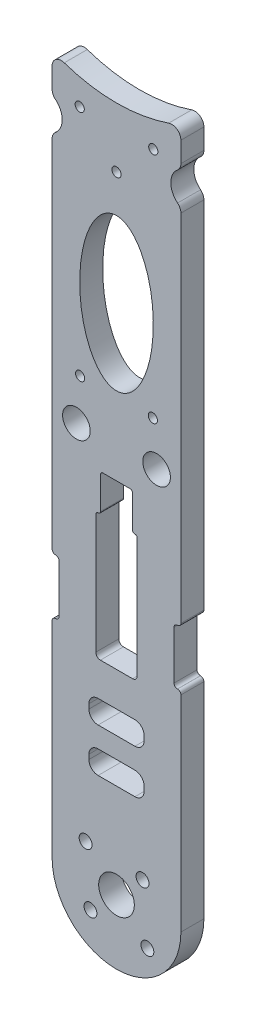
from build123d import *

# Parameters (mm, degrees)
SKETCH1_R           = 1
SKETCH1_R_2         = 1.4
SKETCH1_R_3         = 3
SKETCH1_RX          = 16.5
SKETCH1_RY          = 8
BOSS_EXTRUDE1_DEPTH = 5
CUT_EXTRUDE1_REACH  = 153.803
SKETCH2_R           = 3.875


with BuildPart() as part:
    # Sketch1 → Boss-Extrude1 (new body)
    with BuildSketch(Plane.XY):
        with BuildLine():
            Line((-14, 0), (-14, 44.641437436))
            ThreePointArc((-14, 44.641437436), (-13.783259018, 45.164696454), (-13.26, 45.381437436))
            Line((-13.26, 45.381437436), (-13.24, 45.381437436))
            ThreePointArc((-13.24, 45.381437436), (-12.716740982, 45.598178417), (-12.5, 46.121437436))
            Line((-12.5, 46.121437436), (-12.5, 56.641437436))
            ThreePointArc((-12.5, 56.641437436), (-12.716740982, 57.164696454), (-13.24, 57.381437436))
            Line((-13.24, 57.381437436), (-13.26, 57.381437436))
            ThreePointArc((-13.26, 57.381437436), (-13.783259018, 57.598178417), (-14, 58.121437436))
            Line((-14, 58.121437436), (-14, 135.347392982))
            ThreePointArc((-14, 135.347392982), (-13.809166738, 136.199986504), (-13.273084285, 136.889876824))
            ThreePointArc((-13.273084285, 136.889876824), (-11.805402668, 140.00423401), (-13.273084285, 143.118591196))
            ThreePointArc((-13.273084285, 143.118591196), (-13.809166738, 143.808481515), (-14, 144.661075038))
            Line((-14, 144.661075038), (-14, 149.07320666))
            ThreePointArc((-14, 149.07320666), (-13.162476387, 150.700673602), (-11.351351351, 150.965098552))
            ThreePointArc((-11.351351351, 150.965098552), (0, 149.07320666), (11.351351351, 150.965098552))
            ThreePointArc((11.351351351, 150.965098552), (13.162476387, 150.700673602), (14, 149.07320666))
            Line((14, 149.07320666), (14, 144.661075038))
            ThreePointArc((14, 144.661075038), (13.809166738, 143.808481515), (13.273084285, 143.118591196))
            ThreePointArc((13.273084285, 143.118591196), (11.805402668, 140.00423401), (13.273084285, 136.889876824))
            ThreePointArc((13.273084285, 136.889876824), (13.809166738, 136.199986504), (14, 135.347392982))
            Line((14, 135.347392982), (14, 58.121437436))
            ThreePointArc((14, 58.121437436), (13.783259018, 57.598178417), (13.26, 57.381437436))
            Line((13.26, 57.381437436), (13.24, 57.381437436))
            ThreePointArc((13.24, 57.381437436), (12.716740982, 57.164696454), (12.5, 56.641437436))
            Line((12.5, 56.641437436), (12.5, 46.121437436))
            ThreePointArc((12.5, 46.121437436), (12.716740982, 45.598178417), (13.24, 45.381437436))
            Line((13.24, 45.381437436), (13.26, 45.381437436))
            ThreePointArc((13.26, 45.381437436), (13.783259018, 45.164696454), (14, 44.641437436))
            Line((14, 44.641437436), (14, 0))
            ThreePointArc((14, 0), (0, -14), (-14, 0))
        make_face()
        with Locations((-8, 144.371191598)):
            Circle(SKETCH1_R, mode=Mode.SUBTRACT)
        with Locations((6.717514421, -6.717514421)):
            Circle(SKETCH1_R_2, mode=Mode.SUBTRACT)
        with Locations((-5.656854249, -5.656854249)):
            Circle(SKETCH1_R_2, mode=Mode.SUBTRACT)
        with Locations((5.656854249, 5.656854249)):
            Circle(SKETCH1_R_2, mode=Mode.SUBTRACT)
        with Locations((-6.717514421, 6.717514421)):
            Circle(SKETCH1_R_2, mode=Mode.SUBTRACT)
        with Locations((8, 144.371191598)):
            Circle(SKETCH1_R, mode=Mode.SUBTRACT)
        with Locations((0, 136.07320666)):
            Circle(SKETCH1_R, mode=Mode.SUBTRACT)
        with Locations((-7.903282752, 93.738271437)):
            Circle(SKETCH1_R, mode=Mode.SUBTRACT)
        with Locations((-8.715574275, 84.453736851)):
            Circle(SKETCH1_R_3, mode=Mode.SUBTRACT)
        with Locations((7.903282752, 93.738271437)):
            Circle(SKETCH1_R, mode=Mode.SUBTRACT)
        with Locations((8.715574275, 84.453736851)):
            Circle(SKETCH1_R_3, mode=Mode.SUBTRACT)
        with Locations(Location((0, 111.383897204), (0, 0, 90))):
            Ellipse(SKETCH1_RX, SKETCH1_RY, mode=Mode.SUBTRACT)
        with BuildLine():
            Line((-4, 29.983897204), (4, 29.983897204))
            ThreePointArc((4, 29.983897204), (5.414213562, 30.569683642), (6, 31.983897204))
            Line((6, 31.983897204), (6, 32.983897204))
            ThreePointArc((6, 32.983897204), (5.414213562, 34.398110767), (4, 34.983897204))
            Line((4, 34.983897204), (-4, 34.983897204))
            ThreePointArc((-4, 34.983897204), (-5.414213562, 34.398110767), (-6, 32.983897204))
            Line((-6, 32.983897204), (-6, 31.983897204))
            ThreePointArc((-6, 31.983897204), (-5.414213562, 30.569683642), (-4, 29.983897204))
        make_face(mode=Mode.SUBTRACT)
        with BuildLine():
            Line((-4, 20.483897204), (4, 20.483897204))
            ThreePointArc((4, 20.483897204), (5.414213562, 21.069683642), (6, 22.483897204))
            Line((6, 22.483897204), (6, 23.483897204))
            ThreePointArc((6, 23.483897204), (5.414213562, 24.898110767), (4, 25.483897204))
            Line((4, 25.483897204), (-4, 25.483897204))
            ThreePointArc((-4, 25.483897204), (-5.414213562, 24.898110767), (-6, 23.483897204))
            Line((-6, 23.483897204), (-6, 22.483897204))
            ThreePointArc((-6, 22.483897204), (-5.414213562, 21.069683642), (-4, 20.483897204))
        make_face(mode=Mode.SUBTRACT)
        with BuildLine():
            Line((-3.500986994, 42.444476722), (3.500986994, 42.444476722))
            ThreePointArc((3.500986994, 42.444476722), (4.208093775, 42.737369941), (4.500986994, 43.444476722))
            Line((4.500986994, 43.444476722), (4.500986994, 69.444476722))
            ThreePointArc((4.500986994, 69.444476722), (4.342563749, 69.79336472), (3.98369828, 69.927664143))
            ThreePointArc((3.98369828, 69.927664143), (3.612931699, 70.073454622), (3.466412013, 70.44393364))
            Line((3.466412013, 70.44393364), (3.466412013, 77.44393364))
            ThreePointArc((3.466412013, 77.44393364), (3.318775498, 77.796428519), (2.965292347, 77.941682923))
            Line((2.965292347, 77.941682923), (-2.965292347, 77.941682923))
            ThreePointArc((-2.965292347, 77.941682923), (-3.318775498, 77.796428519), (-3.466412013, 77.44393364))
            Line((-3.466412013, 77.44393364), (-3.466412013, 70.44393364))
            ThreePointArc((-3.466412013, 70.44393364), (-3.612931699, 70.073454622), (-3.98369828, 69.927664143))
            ThreePointArc((-3.98369828, 69.927664143), (-4.342563749, 69.79336472), (-4.500986994, 69.444476722))
            Line((-4.500986994, 69.444476722), (-4.500986994, 43.444476722))
            ThreePointArc((-4.500986994, 43.444476722), (-4.208093775, 42.737369941), (-3.500986994, 42.444476722))
        make_face(mode=Mode.SUBTRACT)
    extrude(amount=BOSS_EXTRUDE1_DEPTH)

    # Sketch2 → Cut-Extrude1 (cut, up to next)
    with BuildSketch(Plane.XY.offset(5), mode=Mode.PRIVATE) as cut_extrude1_sk1:
        Circle(SKETCH2_R)
    cut_extrude1_tool1 = extrude(cut_extrude1_sk1.sketch, amount=-CUT_EXTRUDE1_REACH, mode=Mode.PRIVATE) & part.part
    add(cut_extrude1_tool1.solids().sort_by_distance((0, 0, 5))[0], mode=Mode.SUBTRACT)


solid = part.part
